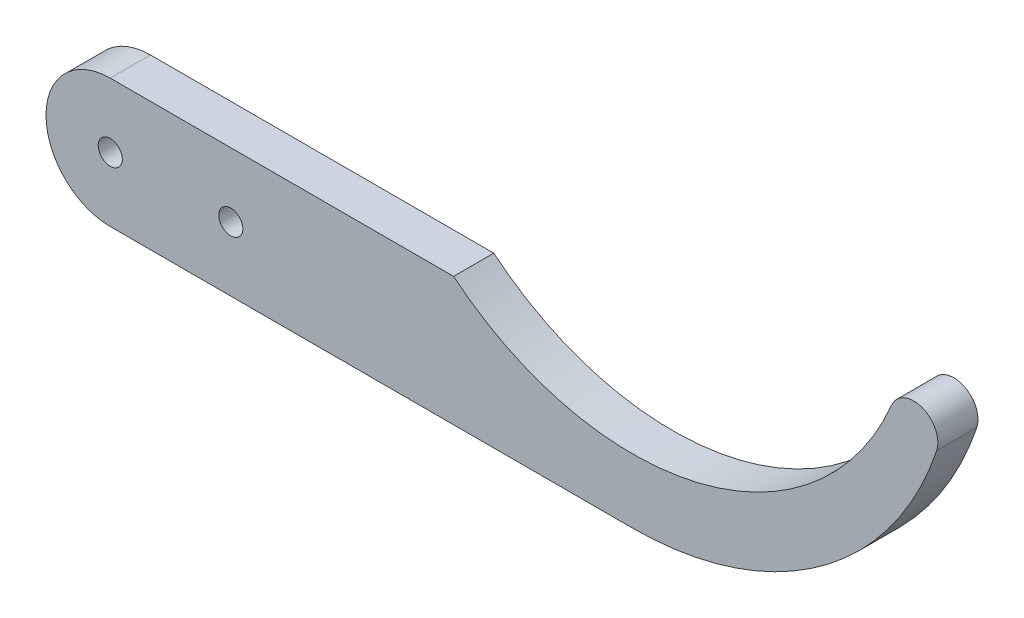
from build123d import *

# Parameters (mm, degrees)
ESQUISSE1_R        = 1.5
BOSS_EXTRU_1_DEPTH = 5


with BuildPart() as part:
    # Esquisse1 → Boss.-Extru.1 (new body)
    with BuildSketch(Plane.XY):
        with BuildLine():
            Line((0, 8), (20, 8))
            Line((20, 8), (27.728942549, 8))
            ThreePointArc((27.728942549, 8), (58.337637956, 1.007592122), (82.236842105, 21.369665775))
            ThreePointArc((82.236842105, 21.369665775), (86.060641355, 23.007601565), (87.845148494, 19.249968185))
            ThreePointArc((87.845148494, 19.249968185), (73.317461433, -0.478698562), (50, -8))
            Line((50, -8), (0, -8))
            Line((0, -8), (-15, -8))
            ThreePointArc((-15, -8), (-23, 0), (-15, 8))
            Line((-15, 8), (0, 8))
        make_face()
        Circle(ESQUISSE1_R, mode=Mode.SUBTRACT)
        with Locations((-15, 0)):
            Circle(ESQUISSE1_R, mode=Mode.SUBTRACT)
    extrude(amount=BOSS_EXTRU_1_DEPTH)


solid = part.part
